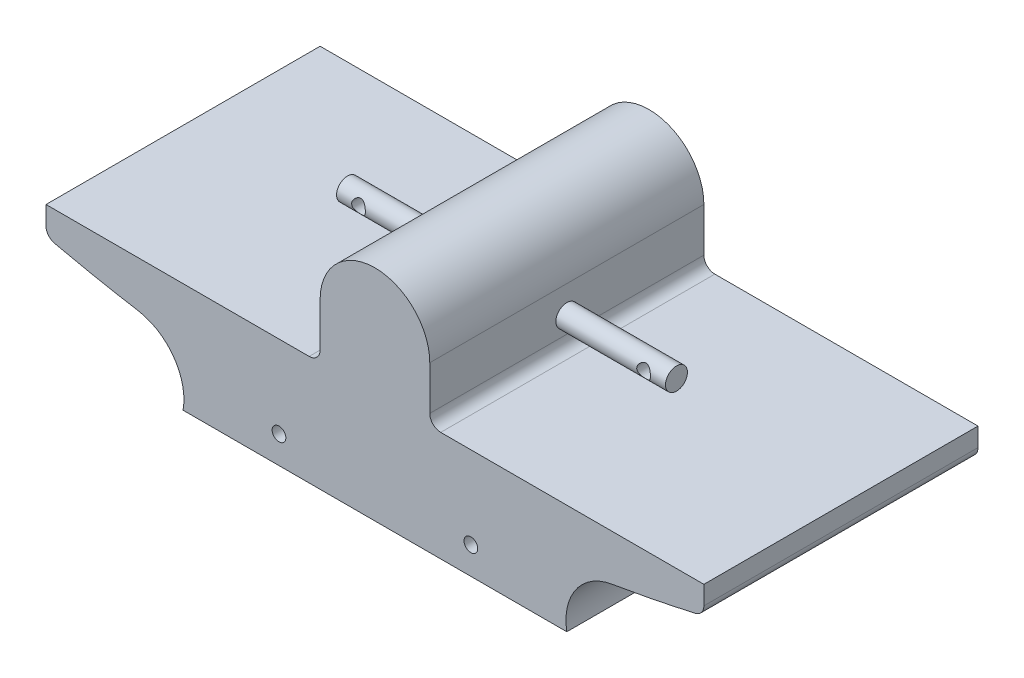
from build123d import *

# Parameters (mm, degrees)
BOSS_EXTRUDE1_DEPTH = 12.5
SKETCH15_R          = 1
BOSS_EXTRUDE2_DEPTH = 10
SKETCH19_R          = 0.625
CUT_EXTRUDE2_DEPTH  = 1
FILLET1_R           = 1
FILLET9_R           = 5
SKETCH32_W          = 30
SKETCH32_H          = 20
CUT_EXTRUDE10_DEPTH = 5
SKETCH34_R          = 0.625
CUT_EXTRUDE9_DEPTH  = 12.5


with BuildPart() as part:
    # Sketch1 → Boss-Extrude1 (new, symmetric)
    with BuildSketch(Plane.XY):
        with BuildLine():
            Line((-30, 2.5), (30, 2.5))
            Line((30, 2.5), (30, 0))
            add(Edge.make_bspline(
                [(-30, 0), (0, -7), (30, 0)],
                knots=[0, 0, 0, 1, 1, 1], degree=2))
            Line((-30, 0), (-30, 2.5))
        make_face()
        with BuildLine():
            Line((5, 7.5), (5, -3.402777778))
            Line((5, -3.402777778), (17.5, -7.5))
            Line((17.5, -7.5), (-17.5, -7.5))
            Line((-17.5, -7.5), (-5, -3.402777778))
            Line((-5, -3.402777778), (-5, 7.5))
            ThreePointArc((-5, 7.5), (0, 12.5), (5, 7.5))
        make_face()
    extrude(amount=BOSS_EXTRUDE1_DEPTH, both=True)

    # Sketch15 → Boss-Extrude2 (add)
    with BuildSketch(Plane(origin=(5, 0, 0), x_dir=(0, 0, -1), z_dir=(1, 0, 0))):
        with Locations((0, 5)):
            Circle(SKETCH15_R)
    boss_extrude2 = extrude(amount=BOSS_EXTRUDE2_DEPTH)

    # Sketch19 → Cut-Extrude2 (cut, symmetric)
    with BuildSketch(Plane.XY):
        with Locations((13, 5)):
            Circle(SKETCH19_R)
    cut_extrude2 = extrude(amount=CUT_EXTRUDE2_DEPTH, both=True, mode=Mode.SUBTRACT)

    # Mirror1: Boss-Extrude2, Cut-Extrude2 across plane
    add(boss_extrude2.mirror(Plane(origin=(0, 0, 0), x_dir=(0, 0, 1), z_dir=(1, 0, 0))))
    add(cut_extrude2.mirror(Plane(origin=(0, 0, 0), x_dir=(0, 0, 1), z_dir=(1, 0, 0))), mode=Mode.SUBTRACT)

    # Fillet1
    fillet1_edges = [part.edges().sort_by_distance(p)[0] for p in [
        (-30, 0, -6.25),
        (30, 0, 6.25),
        (5, 2.5, 0),
        (-5, 2.5, 0),
    ]]
    fillet(fillet1_edges, radius=FILLET1_R)

    # Fillet9
    # the kernel refuses this fillet: 5 mm, written as the material it adds along each edge
    with BuildSketch(Plane(origin=(5, -3.402777778, 12.5), x_dir=(0.9502551587034467, -0.3114725242416856, 0), z_dir=(0, 0, -1))) as fillet9_piece_1_section:
        with BuildLine():
            CenterArc((17.556244054, -2.371377478), FILLET9_R, 151.687811906, 90.630424807)
            Line((15.233443006, -6.799085157), (15.186986985, -6.88763931))
            ThreePointArc((15.186986985, -6.88763931), (7.684520329, -3.247724547), (-0.034816372, -0.093743374))
            Line((-0.034816372, -0.093743374), (0, 0.1))
            ThreePointArc((0, 0.1), (6.577180816, 0.1), (13.066323983, 0.04742755))
            Line((13.066323983, 0.04742755), (13.154361632, 0))
        make_face()
    fillet9_piece_1 = extrude(amount=12.5, mode=Mode.PRIVATE)
    fillet9_piece_1 = split(fillet9_piece_1, bisect_by=Plane(origin=(13.76615202, -7.5, 6.25), z_dir=(0, 1, 0)), keep=Keep.TOP, mode=Mode.PRIVATE)
    add(fillet9_piece_1)
    with BuildSketch(Plane(origin=(-5, -3.402777778, 0), x_dir=(-0.9946948021356532, 0.10287006660984462, 0), z_dir=(0, 0, 1))) as fillet9_piece_2_section:
        with BuildLine():
            CenterArc((16.998391443, 4.989972421), FILLET9_R, 175.740271774, 90.630424807)
            Line((12.012203504, 5.36136148), (11.912479745, 5.368789261))
            ThreePointArc((11.912479745, 5.368789261), (5.965344461, 2.771998007), (-0.040757291, 0.091317267))
            Line((-0.040757291, 0.091317267), (0.006413901, -0.099794097))
            ThreePointArc((0.006413901, -0.099794097), (8.340978482, 0.166269042), (16.675556633, -0.099799448))
            Line((16.675556633, -0.099799448), (16.681886727, 0))
        make_face()
    fillet9_piece_2 = extrude(amount=12.5, mode=Mode.PRIVATE)
    fillet9_piece_2 = split(fillet9_piece_2, bisect_by=Plane(origin=(-13.76615202, -7.5, 6.25), z_dir=(0, 1, 0)), keep=Keep.TOP, mode=Mode.PRIVATE)
    add(fillet9_piece_2)
    with BuildSketch(Plane(origin=(-5, -3.402777778, -12.5), x_dir=(-0.9502551587034468, -0.31147252424168526, 0), z_dir=(0, 0, 1))) as fillet9_piece_3_section:
        with BuildLine():
            CenterArc((17.556244054, -2.371377478), FILLET9_R, 151.687811906, 90.630424807)
            Line((15.233443006, -6.799085157), (15.186986985, -6.88763931))
            ThreePointArc((15.186986985, -6.88763931), (7.684520329, -3.247724547), (-0.034816372, -0.093743374))
            Line((-0.034816372, -0.093743374), (0, 0.1))
            ThreePointArc((0, 0.1), (6.577180816, 0.1), (13.066323983, 0.04742755))
            Line((13.066323983, 0.04742755), (13.154361632, 0))
        make_face()
    fillet9_piece_3 = extrude(amount=12.5, mode=Mode.PRIVATE)
    fillet9_piece_3 = split(fillet9_piece_3, bisect_by=Plane(origin=(-13.76615202, -7.5, -6.25), z_dir=(0, 1, 0)), keep=Keep.TOP, mode=Mode.PRIVATE)
    add(fillet9_piece_3)
    with BuildSketch(Plane(origin=(5, -3.402777778, 0), x_dir=(0.9502551587034467, -0.3114725242416856, 0), z_dir=(0, 0, -1))) as fillet9_piece_4_section:
        with BuildLine():
            CenterArc((17.556244054, -2.371377478), FILLET9_R, 151.687811906, 90.630424807)
            Line((15.233443006, -6.799085157), (15.186986985, -6.88763931))
            ThreePointArc((15.186986985, -6.88763931), (7.684520329, -3.247724547), (-0.034816372, -0.093743374))
            Line((-0.034816372, -0.093743374), (0, 0.1))
            ThreePointArc((0, 0.1), (6.577180816, 0.1), (13.066323983, 0.04742755))
            Line((13.066323983, 0.04742755), (13.154361632, 0))
        make_face()
    fillet9_piece_4 = extrude(amount=12.5, mode=Mode.PRIVATE)
    fillet9_piece_4 = split(fillet9_piece_4, bisect_by=Plane(origin=(13.76615202, -7.5, -6.25), z_dir=(0, 1, 0)), keep=Keep.TOP, mode=Mode.PRIVATE)
    add(fillet9_piece_4)

    # Sketch32 → Cut-Extrude10 (cut)
    with BuildSketch(Plane.XZ.offset(7.5)):
        Rectangle(SKETCH32_W, SKETCH32_H)
    extrude(amount=-CUT_EXTRUDE10_DEPTH, mode=Mode.SUBTRACT)

    # Sketch34 → Cut-Extrude9 (cut, symmetric)
    with BuildSketch(Plane.XY):
        with Locations((-8.75, -5)):
            Circle(SKETCH34_R)
        with Locations((8.75, -5)):
            Circle(SKETCH34_R)
    extrude(amount=CUT_EXTRUDE9_DEPTH, both=True, mode=Mode.SUBTRACT)


solid = part.part
